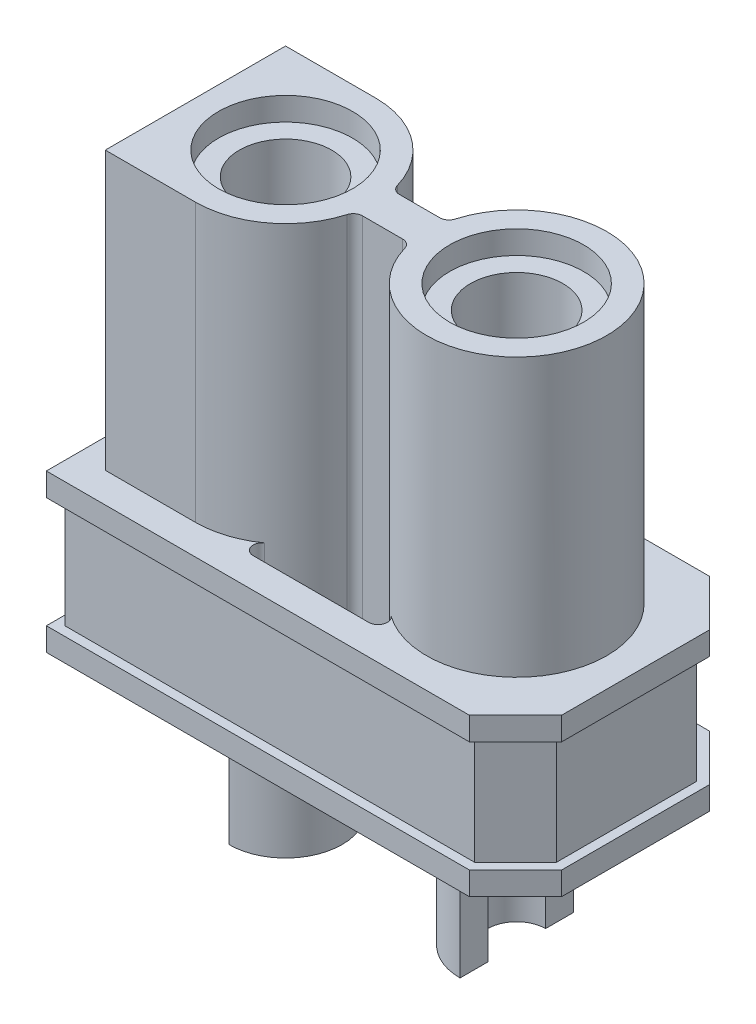
from build123d import *

# Parameters (mm, degrees)
BOSS_EXTRUDE1_DEPTH = 9.4
SKETCH2_R           = 1
CUT_EXTRUDE1_DEPTH  = 6
SKETCH3_R           = 1.45
CUT_EXTRUDE2_DEPTH  = 0.5
CUT_EXTRUDE3_DEPTH  = 1
CUT_EXTRUDE4_REACH  = 10.277
FILLET1_START       = 1
FILLET1_DEPTH       = 2.4
FILLET1_START_2     = 3.146512
FILLET1_2_DEPTH     = 6.253488
SKETCH6_R           = 1.225
SKETCH6_R_2         = 0.625
BOSS_EXTRUDE2_DEPTH = 4
SKETCH7_W           = 1.225
SKETCH7_H           = 2.45
CUT_EXTRUDE5_DEPTH  = 2.3
CUT_EXTRUDE6_DEPTH  = 2.4


with BuildPart() as part:
    # Sketch1 → Boss-Extrude1 (new body)
    with BuildSketch(Plane(origin=(0, 0, 0), x_dir=(1, 0, 0), z_dir=(0, 1, 0))):
        Polygon((5.075, 1.6), (4.075, 2.6), (-5.075, 2.6), (-5.075, -2.6), (4.075, -2.6), (5.075, -1.6), align=None)
    extrude(amount=BOSS_EXTRUDE1_DEPTH)

    # Sketch2 → Cut-Extrude1 (cut)
    # profile 1 of 3: a face of its own
    with BuildSketch(Plane(origin=(0, 9.4, 0), x_dir=(1, 0, 0), z_dir=(0, 1, 0))):
        Polygon((4.075, -2.6), (5.075, -1.6), (5.075, 1.6), (4.075, 2.6), (-5.075, 2.6), (-5.075, -2.6), align=None)
        with BuildLine():
            Line((-2.5, -1.95), (-4.45, -1.95))
            Line((-4.45, -1.95), (-4.45, 1.95))
            Line((-4.45, 1.95), (-2.5, 1.95))
            ThreePointArc((-2.5, 1.95), (-1.270670915, 1.51368755), (-0.591466532, 0.4))
            Line((-0.591466532, 0.4), (0.591466532, 0.4))
            ThreePointArc((0.591466532, 0.4), (4.45, 0), (0.591466532, -0.4))
            Line((0.591466532, -0.4), (-0.591466532, -0.4))
            ThreePointArc((-0.591466532, -0.4), (-1.270670915, -1.51368755), (-2.5, -1.95))
        make_face(mode=Mode.SUBTRACT)
    # profile 2 of 3: a face of its own
    with BuildSketch(Plane(origin=(0, 9.4, 0), x_dir=(1, 0, 0), z_dir=(0, 1, 0))):
        with Locations(Location((2.5, 0, 0), (0, 0, 270))):
            Circle(SKETCH2_R)
    # profile 3 of 3: a face of its own
    with BuildSketch(Plane(origin=(0, 9.4, 0), x_dir=(1, 0, 0), z_dir=(0, 1, 0))):
        with Locations(Location((-2.5, 0, 0), (0, 0, 270))):
            Circle(SKETCH2_R)
    extrude(amount=-CUT_EXTRUDE1_DEPTH, mode=Mode.SUBTRACT)

    # Sketch3 → Cut-Extrude2 (cut)
    with BuildSketch(Plane(origin=(0, 9.4, 0), x_dir=(1, 0, 0), z_dir=(0, 1, 0))):
        with Locations(Location((-2.5, 0, 0), (0, 0, 270))):
            Circle(SKETCH3_R)
        with Locations(Location((2.5, 0, 0), (0, 0, 270))):
            Circle(SKETCH3_R)
    extrude(amount=-CUT_EXTRUDE2_DEPTH, mode=Mode.SUBTRACT)

    # Sketch4 → Cut-Extrude3 (cut)
    with BuildSketch(Plane.XZ):
        Polygon((3.826471863, 2), (-4.475, 2), (-4.475, -2), (3.826471863, -2), (4.475, -1.351471863), (4.475, 1.351471863), align=None)
    extrude(amount=-CUT_EXTRUDE3_DEPTH, mode=Mode.SUBTRACT)

    # Sketch5 → Cut-Extrude4 (cut, up to next)
    with BuildSketch(Plane(origin=(0, 3.4, 0), x_dir=(1, 0, 0), z_dir=(0, 1, 0)), mode=Mode.PRIVATE) as cut_extrude4_sk1:
        with BuildLine():
            Line((2.5, 1.95), (-2.5, 1.95))
            ThreePointArc((-2.5, 1.95), (-1.270670915, 1.51368755), (-0.591466532, 0.4))
            Line((-0.591466532, 0.4), (0.591466532, 0.4))
            ThreePointArc((0.591466532, 0.4), (1.270670915, 1.51368755), (2.5, 1.95))
        make_face()
    cut_extrude4_tool1 = extrude(cut_extrude4_sk1.sketch, amount=-CUT_EXTRUDE4_REACH, mode=Mode.PRIVATE) & part.part
    # Sketch5 → Cut-Extrude4 (cut, up to next)
    with BuildSketch(Plane(origin=(0, 3.4, 0), x_dir=(1, 0, 0), z_dir=(0, 1, 0)), mode=Mode.PRIVATE) as cut_extrude4_sk2:
        with BuildLine():
            Line((-2.5, -1.95), (2.5, -1.95))
            ThreePointArc((2.5, -1.95), (1.270670915, -1.51368755), (0.591466532, -0.4))
            Line((0.591466532, -0.4), (-0.591466532, -0.4))
            ThreePointArc((-0.591466532, -0.4), (-1.270670915, -1.51368755), (-2.5, -1.95))
        make_face()
    cut_extrude4_tool2 = extrude(cut_extrude4_sk2.sketch, amount=-CUT_EXTRUDE4_REACH, mode=Mode.PRIVATE) & part.part
    add(cut_extrude4_tool1.solids().sort_by_distance((0, 3.4, -1.344451))[0], mode=Mode.SUBTRACT)
    add(cut_extrude4_tool2.solids().sort_by_distance((0, 3.4, 1.344451))[0], mode=Mode.SUBTRACT)

    # Fillet1: read off the stored shape, not the designer's step
    # Fillet1 outline → Fillet1 (add)
    with BuildSketch(Plane(origin=(0, 0, 0), x_dir=(1, 0, 0), z_dir=(0, 1, 0)).offset(FILLET1_START)):
        with BuildLine():
            ThreePointArc((1.36718641, 1.587209302), (1.905255576, 1.85708887), (2.5, 1.95))
            Line((2.5, 1.95), (1.2510004, 1.95))
            ThreePointArc((1.2510004, 1.95), (1.441471054, 1.810999428), (1.36718641, 1.587209302))
        make_face()
        with BuildLine():
            ThreePointArc((1.36718641, -1.587209302), (1.441471054, -1.810999428), (1.2510004, -1.95))
            Line((1.2510004, -1.95), (2.5, -1.95))
            ThreePointArc((2.5, -1.95), (1.905255576, -1.85708887), (1.36718641, -1.587209302))
        make_face()
        with BuildLine():
            Line((-2.5, -1.95), (-1.2510004, -1.95))
            ThreePointArc((-1.2510004, -1.95), (-1.441471054, -1.810999428), (-1.36718641, -1.587209302))
            ThreePointArc((-1.36718641, -1.587209302), (-1.905255576, -1.857088869), (-2.5, -1.95))
        make_face()
        with BuildLine():
            ThreePointArc((0.435417718, -0.4), (0.555495212, -0.44005815), (0.627471884, -0.544186047))
            ThreePointArc((0.627471884, -0.544186047), (0.608095119, -0.472436154), (0.591466532, -0.4))
            Line((0.591466532, -0.4), (0.435417718, -0.4))
        make_face()
        with BuildLine():
            ThreePointArc((-0.591466532, -0.4), (-0.608095119, -0.472436154), (-0.627471884, -0.544186047))
            ThreePointArc((-0.627471884, -0.544186047), (-0.555495212, -0.44005815), (-0.435417718, -0.4))
            Line((-0.435417718, -0.4), (-0.591466532, -0.4))
        make_face()
        with BuildLine():
            ThreePointArc((-1.36718641, 1.587209302), (-1.441471054, 1.810999428), (-1.2510004, 1.95))
            Line((-1.2510004, 1.95), (-2.5, 1.95))
            ThreePointArc((-2.5, 1.95), (-1.905255576, 1.857088869), (-1.36718641, 1.587209302))
        make_face()
        with BuildLine():
            ThreePointArc((0.591466532, 0.4), (0.608095119, 0.472436154), (0.627471884, 0.544186047))
            ThreePointArc((0.627471884, 0.544186047), (0.555495212, 0.44005815), (0.435417718, 0.4))
            Line((0.435417718, 0.4), (0.591466532, 0.4))
        make_face()
        with BuildLine():
            ThreePointArc((-0.435417718, 0.4), (-0.555495212, 0.44005815), (-0.627471884, 0.544186047))
            ThreePointArc((-0.627471884, 0.544186047), (-0.608095119, 0.472436154), (-0.591466532, 0.4))
            Line((-0.591466532, 0.4), (-0.435417718, 0.4))
        make_face()
    extrude(amount=FILLET1_DEPTH)

    # Fillet1 2 outline → Fillet1 2 (add)
    with BuildSketch(Plane(origin=(0, 0, 0), x_dir=(1, 0, 0), z_dir=(0, 1, 0)).offset(FILLET1_START_2)):
        with BuildLine():
            ThreePointArc((0.435417718, -0.4), (0.555495212, -0.44005815), (0.627471884, -0.544186047))
            ThreePointArc((0.627471884, -0.544186047), (0.608095119, -0.472436154), (0.591466532, -0.4))
            Line((0.591466532, -0.4), (0.435417718, -0.4))
        make_face()
        with BuildLine():
            ThreePointArc((-0.591466532, -0.4), (-0.608095119, -0.472436154), (-0.627471884, -0.544186047))
            ThreePointArc((-0.627471884, -0.544186047), (-0.555495212, -0.44005815), (-0.435417718, -0.4))
            Line((-0.435417718, -0.4), (-0.591466532, -0.4))
        make_face()
        with BuildLine():
            ThreePointArc((0.591466532, 0.4), (0.608095119, 0.472436154), (0.627471884, 0.544186047))
            ThreePointArc((0.627471884, 0.544186047), (0.555495212, 0.44005815), (0.435417718, 0.4))
            Line((0.435417718, 0.4), (0.591466532, 0.4))
        make_face()
        with BuildLine():
            ThreePointArc((-0.435417718, 0.4), (-0.555495212, 0.44005815), (-0.627471884, 0.544186047))
            ThreePointArc((-0.627471884, 0.544186047), (-0.608095119, 0.472436154), (-0.591466532, 0.4))
            Line((-0.591466532, 0.4), (-0.435417718, 0.4))
        make_face()
    extrude(amount=FILLET1_2_DEPTH)

    # Sketch6 → Boss-Extrude2 (add)
    # profile 1 of 2: a face of its own
    with BuildSketch(Plane.XZ.offset(-1)):
        with Locations(Location((-2.5, 0, 0), (0, 0, 90))):
            Circle(SKETCH6_R)
        with Locations(Location((-2.5, 0, 0), (0, 0, 270))):
            Circle(SKETCH6_R_2, mode=Mode.SUBTRACT)
    # profile 2 of 2: a face of its own
    with BuildSketch(Plane.XZ.offset(-1)):
        with Locations(Location((2.5, 0, 0), (0, 0, 90))):
            Circle(SKETCH6_R)
        with Locations(Location((2.5, 0, 0), (0, 0, 90))):
            Circle(SKETCH6_R_2, mode=Mode.SUBTRACT)
    extrude(amount=BOSS_EXTRUDE2_DEPTH)

    # Sketch7 → Cut-Extrude5 (cut)
    with BuildSketch(Plane.XZ.offset(3)):
        with Locations((-3.1125, 0)):
            Rectangle(SKETCH7_W, SKETCH7_H)
        with Locations((3.1125, 0)):
            Rectangle(SKETCH7_W, SKETCH7_H)
    extrude(amount=-CUT_EXTRUDE5_DEPTH, mode=Mode.SUBTRACT)

    # Sketch8 → Cut-Extrude6 (cut)
    with BuildSketch(Plane(origin=(0, 0.5, 0), x_dir=(-1, 0, 0), z_dir=(0, -1, 0))):
        Polygon((-4.075, -2.6), (5.075, -2.6), (5.075, 2.6), (-4.075, 2.6), (-5.075, 1.6), (-5.075, -1.6), align=None)
        Polygon((-3.992157288, -2.4), (4.875, -2.4), (4.875, 2.4), (-3.992157288, 2.4), (-4.875, 1.517157288), (-4.875, -1.517157288), align=None, mode=Mode.SUBTRACT)
    extrude(amount=-CUT_EXTRUDE6_DEPTH, mode=Mode.SUBTRACT)


solid = part.part
